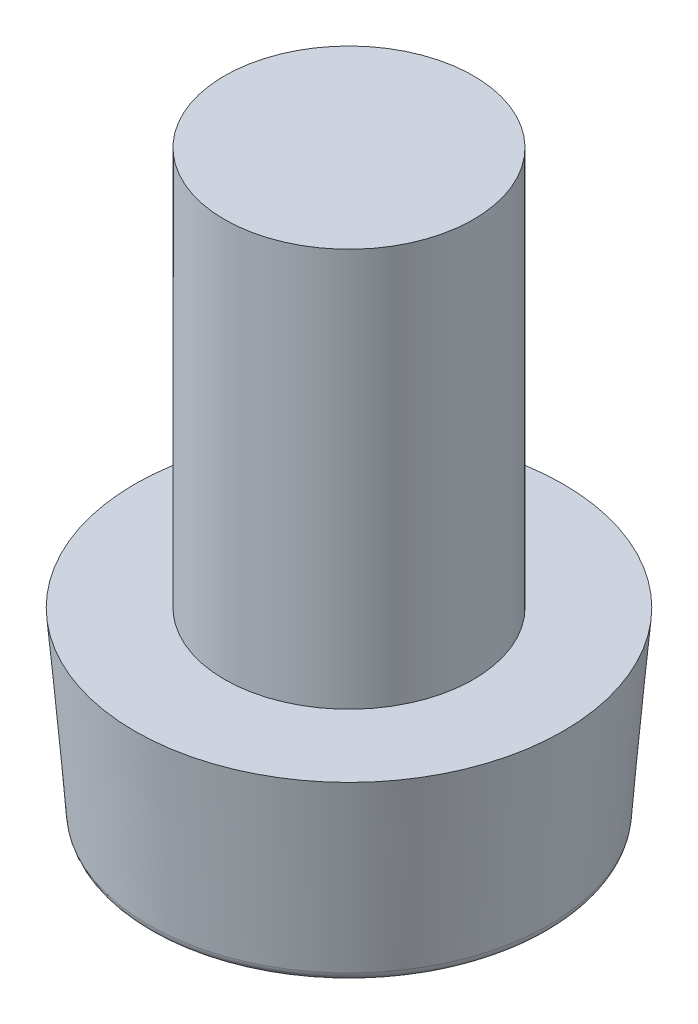
from build123d import *

# Parameters (mm, degrees)
ESQUISSE1_R        = 2.15
BOSS_EXTRU_1_DEPTH = 1.85
ESQUISSE2_R        = 1.25
BOSS_EXTRU_2_DEPTH = 4
CHANFREIN1_SIZE    = 1.85
CHANFREIN1_SIZE_2  = 0.15
CONG_1_R           = 0.1


with BuildPart() as part:
    # Esquisse1 → Boss.-Extru.1 (new body)
    with BuildSketch(Plane(origin=(0, 0, 0), x_dir=(1, 0, 0), z_dir=(0, 1, 0))):
        with Locations(Location((0, 0, 0), (0, 0, 270))):
            Circle(ESQUISSE1_R)
    extrude(amount=BOSS_EXTRU_1_DEPTH)

    # Esquisse2 → Boss.-Extru.2 (add)
    with BuildSketch(Plane(origin=(0, 1.85, 0), x_dir=(1, 0, 0), z_dir=(0, 1, 0))):
        with Locations(Location((0, 0, 0), (0, 0, 270))):
            Circle(ESQUISSE2_R)
    extrude(amount=BOSS_EXTRU_2_DEPTH)

    # Chanfrein1
    # the kernel refuses this chamfer: 1.85, 0.15 mm, written as the material it takes off along each edge
    with BuildSketch(Plane(origin=(0, 0, 0), x_dir=(0, 0, 1), z_dir=(-1, 0, 0))) as chanfrein1_piece_1:
        Polygon((2.15, CHANFREIN1_SIZE), (2.15 - CHANFREIN1_SIZE_2, 0), (2.15, 0), align=None)
    revolve(axis=Axis((0, 0, 0), (0, 1, 0)), mode=Mode.SUBTRACT)

    # Congé1
    cong_1_edges = [part.edges().sort_by_distance(p)[0] for p in [
        (0, 0, -2),
    ]]
    fillet(cong_1_edges, radius=CONG_1_R)


solid = part.part
